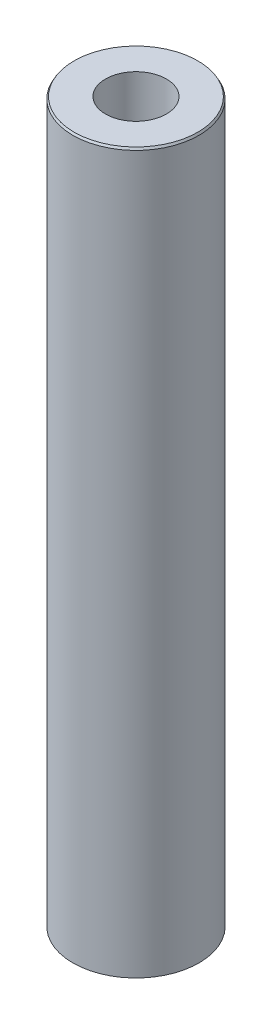
from build123d import *
from OCP.BRepFilletAPI import BRepFilletAPI_MakeChamfer

# Parameters (mm, degrees)
SKETCH1_R           = 45
BOSS_EXTRUDE1_DEPTH = 513.737910442
SKETCH2_R           = 21.717017063
CUT_EXTRUDE1_DEPTH  = 518.664602446
CHAMFER1_SIZE       = 1.500535232
CHAMFER1_SIZE2      = 0.86633442


with BuildPart() as part:
    # Sketch1 → Boss-Extrude1 (new body)
    with BuildSketch(Plane(origin=(0, 0, 0), x_dir=(1, 0, 0), z_dir=(0, 1, 0))):
        Circle(SKETCH1_R)
    extrude(amount=BOSS_EXTRUDE1_DEPTH)

    # Sketch2 → Cut-Extrude1 (cut, through all)
    with BuildSketch(Plane(origin=(0, 0, 0), x_dir=(1, 0, 0), z_dir=(0, 1, 0))):
        Circle(SKETCH2_R)
    extrude(amount=CUT_EXTRUDE1_DEPTH, mode=Mode.SUBTRACT)

    # Chamfer1: one chamfer whose edges measure the first distance from different faces: ONE call of the kernel's chamfer builder (chamfer() names one face for all edges)
    chamfer1_edges_1 = [part.edges().sort_by_distance(p)[0] for p in [
        (-45, 513.737910442, 0),
    ]]
    chamfer1_side_1 = [part.faces().sort_by_distance(p)[0] for p in [
        (-45, 256.868955221, 0),
    ]]
    chamfer1_edges_2 = [part.edges().sort_by_distance(p)[0] for p in [
        (-45, 0, 0),
    ]]
    chamfer1_side_2 = [part.faces().sort_by_distance(p)[0] for p in [
        (-43.727207794, 0, 0),
    ]]
    chamfer1 = BRepFilletAPI_MakeChamfer(part.part.solid().wrapped)
    for e in chamfer1_edges_1:
        chamfer1.Add(CHAMFER1_SIZE, CHAMFER1_SIZE2, e.wrapped, chamfer1_side_1[0].wrapped)  # the first distance lies on this face
    for e in chamfer1_edges_2:
        chamfer1.Add(CHAMFER1_SIZE, CHAMFER1_SIZE2, e.wrapped, chamfer1_side_2[0].wrapped)  # the first distance lies on this face
    add(Compound.cast(chamfer1.Shape()), mode=Mode.REPLACE)


solid = part.part
